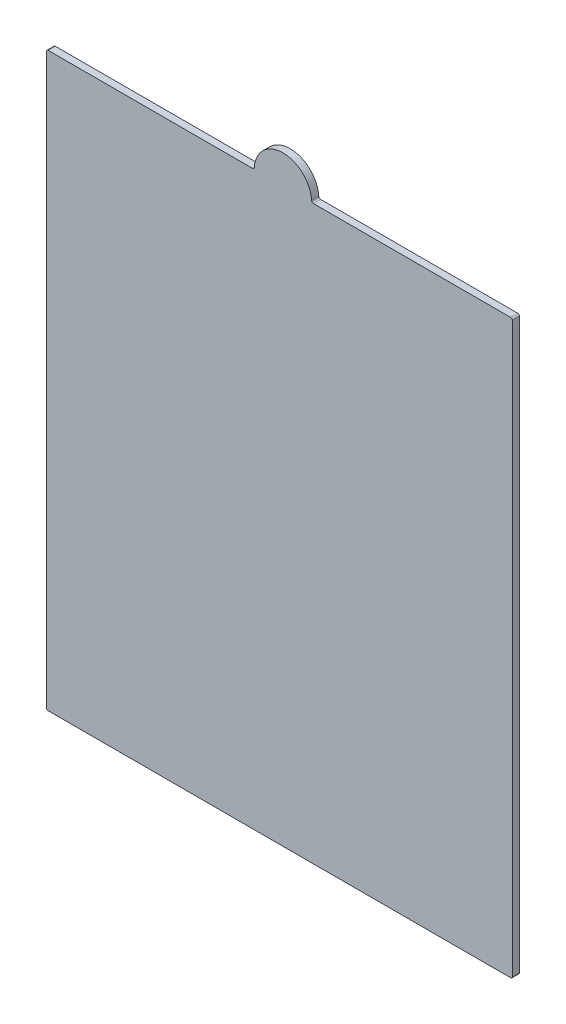
from build123d import *

# Parameters (mm, degrees)
SKETCH1_W           = 206.253
SKETCH1_H           = 253.103
BOSS_EXTRUDE1_DEPTH = 3.175
BOSS_EXTRUDE3_DEPTH = 3.175
FILLET1_R           = 0.79375


with BuildPart() as part:
    # Sketch1 → Boss-Extrude1 (new body)
    with BuildSketch(Plane.XY):
        with Locations((103.1265, 126.5515)):
            Rectangle(SKETCH1_W, SKETCH1_H)
    extrude(amount=BOSS_EXTRUDE1_DEPTH)

    # Sketch3 → Boss-Extrude3 (add)
    with BuildSketch(Plane.XY):
        with BuildLine():
            Line((92.003931261, 253.103), (117.403931261, 253.103))
            ThreePointArc((117.403931261, 253.103), (104.703931261, 265.803), (92.003931261, 253.103))
        make_face()
    extrude(amount=BOSS_EXTRUDE3_DEPTH)

    # Fillet1
    fillet1_edges = [part.edges().sort_by_distance(p)[0] for p in [
        (0, 0, 1.5875),
        (206.253, 0, 1.5875),
        (206.253, 253.103, 1.5875),
        (0, 253.103, 1.5875),
        (92.003931261, 253.103, 1.5875),
        (117.403931261, 253.103, 1.5875),
    ]]
    fillet(fillet1_edges, radius=FILLET1_R)


solid = part.part
